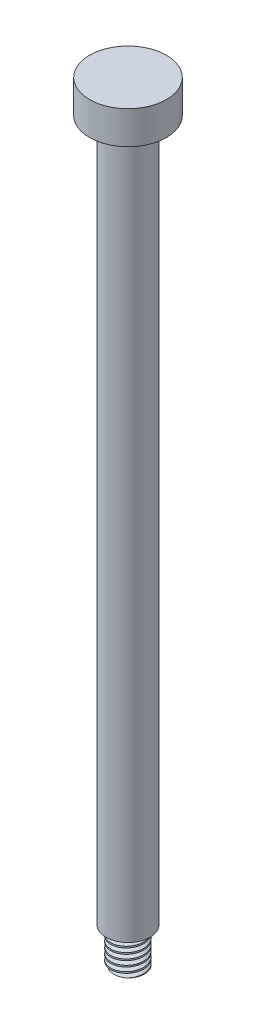
from build123d import *

# Parameters (mm, degrees)
CROQUIS1_R              = 6.35
SALIENTE_EXTRUIR1_DEPTH = 202.7
CROQUIS2_R              = 11.1125
SALIENTE_EXTRUIR2_DEPTH = 9.525
CROQUIS3_R              = 4.7625
SALIENTE_EXTRUIR3_DEPTH = 10
CORTAR_BARRER1_PITCH    = 1.5875


with BuildPart() as part:
    # Croquis1 → Saliente-Extruir1 (new body)
    with BuildSketch(Plane(origin=(0, 0, 0), x_dir=(1, 0, 0), z_dir=(0, 1, 0))):
        with Locations(Location((0, 0, 0), (0, 0, 90))):
            Circle(CROQUIS1_R)
    extrude(amount=SALIENTE_EXTRUIR1_DEPTH)

    # Croquis2 → Saliente-Extruir2 (add)
    with BuildSketch(Plane(origin=(0, 202.7, 0), x_dir=(1, 0, 0), z_dir=(0, 1, 0))):
        with Locations(Location((0, 0, 0), (0, 0, 270))):
            Circle(CROQUIS2_R)
    extrude(amount=SALIENTE_EXTRUIR2_DEPTH)

    # Croquis3 → Saliente-Extruir3 (add)
    with BuildSketch(Plane.XZ):
        with Locations(Location((0, 0, 0), (0, 0, 270))):
            Circle(CROQUIS3_R)
    extrude(amount=SALIENTE_EXTRUIR3_DEPTH)

    # Cortar-Barrer1: arcs per turn and ends read off the stored shape
    # Cortar-Barrer1: the profile of Croquis5 profile screwed along a right-hand helix through 8 turns, 8 arcs to a turn; built about Z, then put on its axis
    cortar_barrer1_z = Axis((0, 0, 0), (0, 0, 1))
    cortar_barrer1_corners = [(4.7628, 0, -2.165023474), (4.7628, 0, -1.009976526), (3.7625, 0, -1.5875)]
    with BuildLine(mode=Mode.PRIVATE) as cortar_barrer1_profile:
        Line(cortar_barrer1_corners[0], cortar_barrer1_corners[1])
        Line(cortar_barrer1_corners[1], cortar_barrer1_corners[2])
        Line(cortar_barrer1_corners[2], cortar_barrer1_corners[0])
    cortar_barrer1_cap = Face(cortar_barrer1_profile.wire())
    cortar_barrer1_turn_angles = [0, 22.5, 45, 67.5, 90, 112.5, 135, 157.5, 180, 202.5, 225, 247.5, 270, 292.5, 315, 337.5, 360]
    cortar_barrer1_turn_weights = [1, 0.9238795325112867, 1, 0.9238795325112867, 1, 0.9238795325112867, 1, 0.9238795325112867, 1, 0.9238795325112867, 1, 0.9238795325112867, 1, 0.9238795325112867, 1, 0.9238795325112867, 1]
    cortar_barrer1_turn_rails = [Edge.make_bspline([Vector(p[0], p[1], 0).rotate(cortar_barrer1_z, cortar_barrer1_turn_angles[k]) / cortar_barrer1_turn_weights[k] + Vector(0, 0, p[2] + CORTAR_BARRER1_PITCH * cortar_barrer1_turn_angles[k] / 360) for k in range(17)], [0, 0, 0, 1, 1, 2, 2, 3, 3, 4, 4, 5, 5, 6, 6, 7, 7, 8, 8, 8], 2, cortar_barrer1_turn_weights) for p in cortar_barrer1_corners]
    cortar_barrer1_turn_sides = [Face.make_surface_from_curves(cortar_barrer1_turn_rails[p[0]], cortar_barrer1_turn_rails[p[1]]) for p in [(0, 1), (1, 2), (2, 0)]]
    cortar_barrer1 = Plane(origin=(0, -10, 0), x_dir=(-1, 0, 0), z_dir=(0, 1, 0)) * Solid(Shell([*[p.moved(Location((0, 0, CORTAR_BARRER1_PITCH * i))) for i in range(8) for p in cortar_barrer1_turn_sides], cortar_barrer1_cap, cortar_barrer1_cap.rotate(cortar_barrer1_z, 2880).moved(Location((0, 0, CORTAR_BARRER1_PITCH * 2880 / 360)))]))
    add(cortar_barrer1, mode=Mode.SUBTRACT)


solid = part.part
